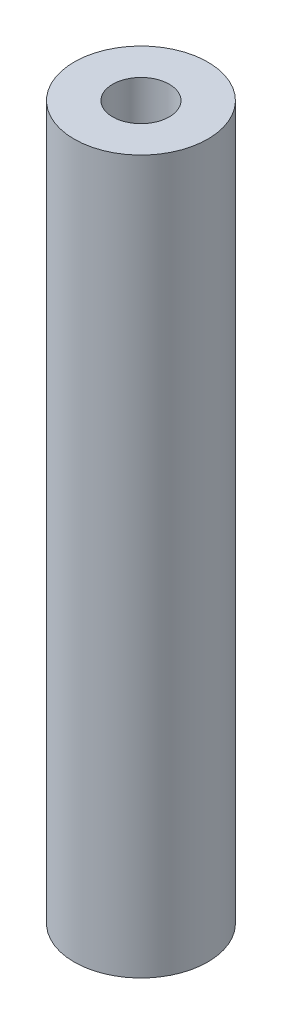
from build123d import *

# Parameters (mm, degrees)
SKETCH1_R                            = 4.7625
BOSS_EXTRUDE1_DEPTH                  = 25.4
F_10_32_TAPPED_HOLE1_D               = 4.0386
F_10_32_TAPPED_HOLE1_DEPTH           = 11.938
F_10_32_TAPPED_HOLE1_TIP             = 1.213317848
F_10_32_TAPPED_HOLE1_ON_FACE_2_D     = 4.0386
F_10_32_TAPPED_HOLE1_ON_FACE_2_DEPTH = 11.938
F_10_32_TAPPED_HOLE1_ON_FACE_2_TIP   = 1.213317848


with BuildPart() as part:
    # Sketch1 → Boss-Extrude1 (new, symmetric)
    with BuildSketch(Plane(origin=(0, 0, 0), x_dir=(1, 0, 0), z_dir=(0, 1, 0))):
        Circle(SKETCH1_R)
    extrude(amount=BOSS_EXTRUDE1_DEPTH, both=True)

    # #10-32 Tapped Hole1
    with Locations(Plane(origin=(0, -25.4, 0), x_dir=(0, 0, -1), z_dir=(0, -1, 0))):
        with Locations((0, 0)):
            Hole(F_10_32_TAPPED_HOLE1_D / 2, depth=F_10_32_TAPPED_HOLE1_DEPTH)
            with Locations((0, 0, -(F_10_32_TAPPED_HOLE1_DEPTH + F_10_32_TAPPED_HOLE1_TIP / 2))):  # 118° drill point
                Cone(0, F_10_32_TAPPED_HOLE1_D / 2, F_10_32_TAPPED_HOLE1_TIP, mode=Mode.SUBTRACT)

    # #10-32 Tapped Hole1 on face 2
    with Locations(Plane.ZX.offset(25.4)):
        with Locations((0, 0)):
            Hole(F_10_32_TAPPED_HOLE1_ON_FACE_2_D / 2, depth=F_10_32_TAPPED_HOLE1_ON_FACE_2_DEPTH)
            with Locations((0, 0, -(F_10_32_TAPPED_HOLE1_ON_FACE_2_DEPTH + F_10_32_TAPPED_HOLE1_ON_FACE_2_TIP / 2))):  # 118° drill point
                Cone(0, F_10_32_TAPPED_HOLE1_ON_FACE_2_D / 2, F_10_32_TAPPED_HOLE1_ON_FACE_2_TIP, mode=Mode.SUBTRACT)


solid = part.part
